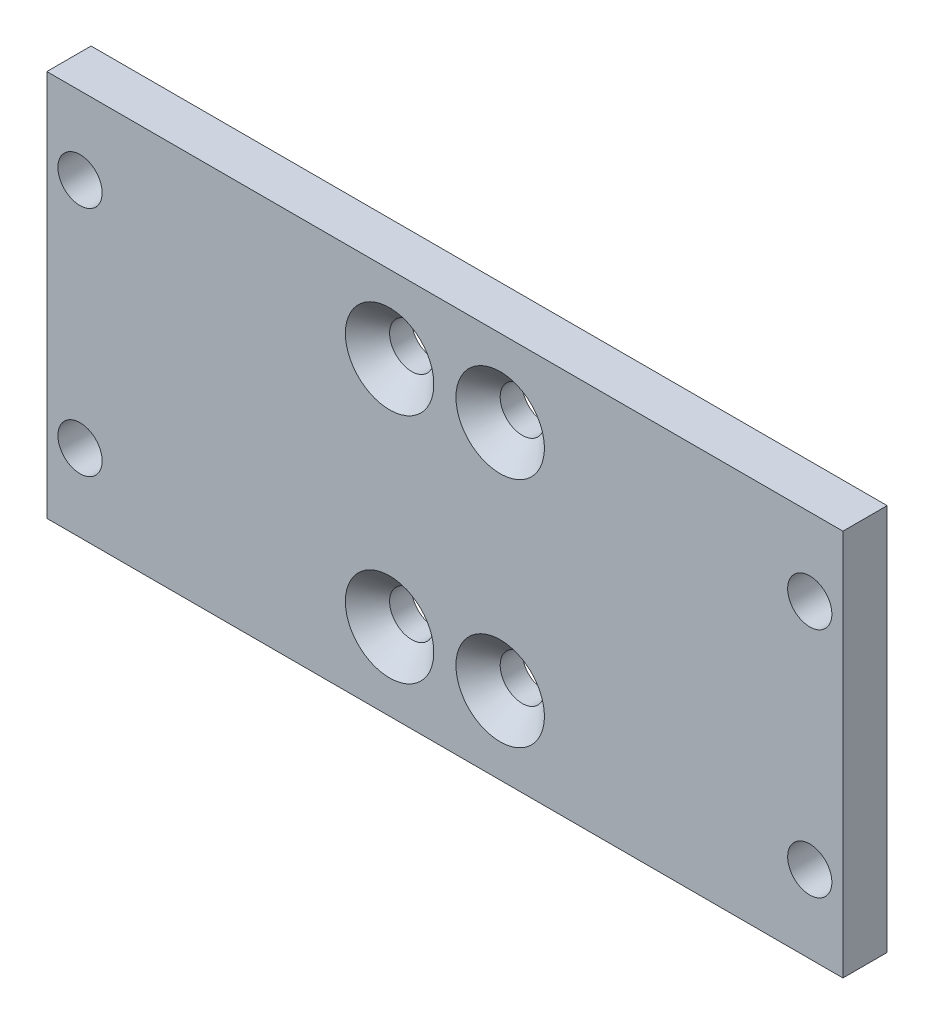
from build123d import *

# Parameters (mm, degrees)
SKETCH1_W           = 72
SKETCH1_H           = 35
SKETCH1_R           = 2
BOSS_EXTRUDE1_DEPTH = 4
CHAMFER1_SIZE       = 2


with BuildPart() as part:
    # Sketch1 → Boss-Extrude1 (new body)
    with BuildSketch(Plane.XY):
        with Locations((-9.877186938, -12.648960327)):
            Rectangle(SKETCH1_W, SKETCH1_H)
        with Locations((-14.877186938, -2.148960327)):
            Circle(SKETCH1_R, mode=Mode.SUBTRACT)
        with Locations((-4.877186938, -2.148960327)):
            Circle(SKETCH1_R, mode=Mode.SUBTRACT)
        with Locations((-42.877186938, -2.148960327)):
            Circle(SKETCH1_R, mode=Mode.SUBTRACT)
        with Locations((23.122813062, -2.148960327)):
            Circle(SKETCH1_R, mode=Mode.SUBTRACT)
        with Locations((23.122813062, -23.148960327)):
            Circle(SKETCH1_R, mode=Mode.SUBTRACT)
        with Locations((-42.877186938, -23.148960327)):
            Circle(SKETCH1_R, mode=Mode.SUBTRACT)
        with Locations((-4.877186938, -23.148960327)):
            Circle(SKETCH1_R, mode=Mode.SUBTRACT)
        with Locations((-14.877186938, -23.148960327)):
            Circle(SKETCH1_R, mode=Mode.SUBTRACT)
    extrude(amount=BOSS_EXTRUDE1_DEPTH)

    # Chamfer1
    chamfer1_edges = [part.edges().sort_by_distance(p)[0] for p in [
        (-16.877186938, -23.148960327, 4),
        (-6.877186938, -23.148960327, 4),
        (-6.877186938, -2.148960327, 4),
        (-16.877186938, -2.148960327, 4),
    ]]
    chamfer(chamfer1_edges, length=CHAMFER1_SIZE)


solid = part.part
